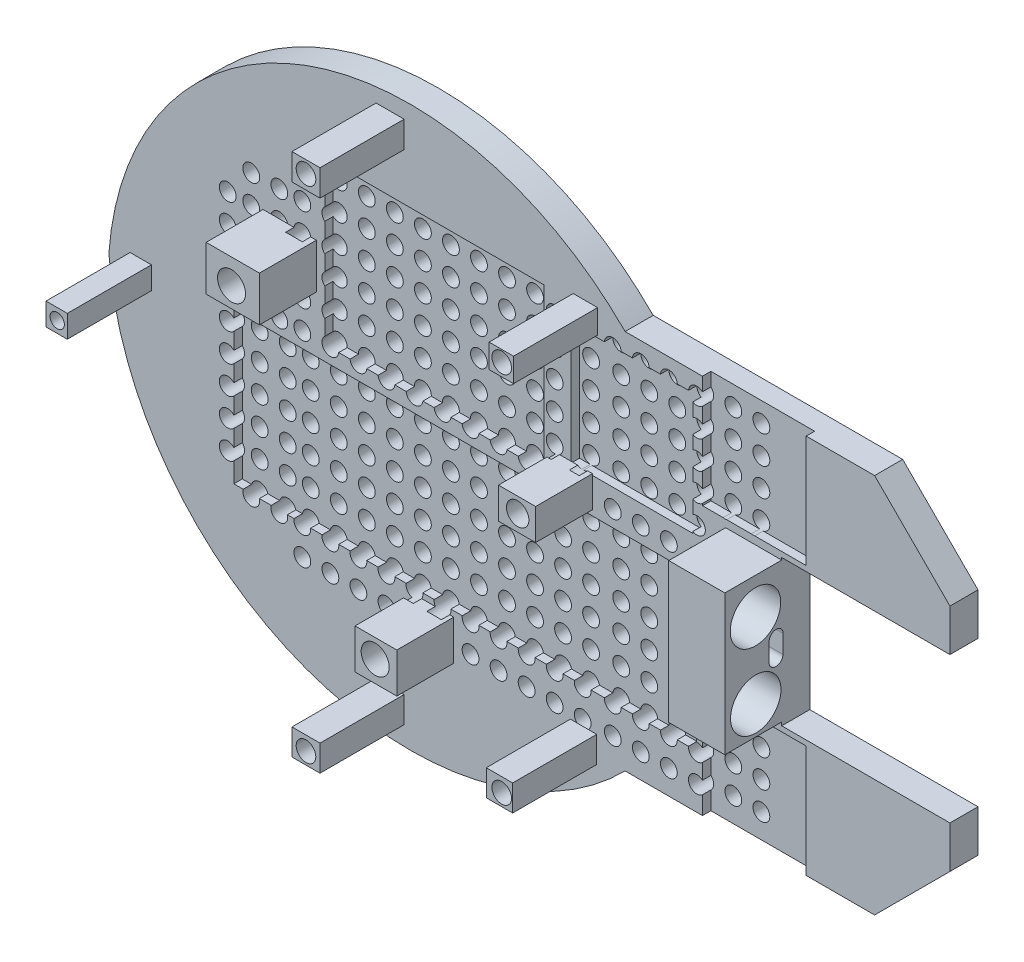
from build123d import *

# Parameters (mm, degrees)
BOSS_EXTRUDE1_DEPTH      = 10
BOSS_EXTRUDE1_DEPTH_BACK = 0.01
SKETCH3_W                = 37
SKETCH3_H                = 40
CUT_EXTRUDE1_DEPTH       = 3
SKETCH5_W                = 37
SKETCH5_H                = 40
CUT_EXTRUDE3_DEPTH       = 3
SKETCH7_W                = 165
SKETCH7_H                = 54
CUT_EXTRUDE4_DEPTH       = 3
SKETCH8_W                = 78.2
SKETCH8_H                = 57.5
CUT_EXTRUDE5_DEPTH       = 3
SKETCH9_W                = 19
SKETCH9_H                = 16
SKETCH9_W_2              = 13.23867097
SKETCH9_H_2              = 11.14338859
SKETCH9_W_3              = 14.8958404
SKETCH9_H_3              = 14.23867097
BOSS_EXTRUDE2_DEPTH      = 20.3
SKETCH11_R               = 3
CUT_EXTRUDE12_DEPTH      = 13
CUT_EXTRUDE13_REACH      = 263.683
SKETCH12_R               = 3
CUT_EXTRUDE14_REACH      = 263.683
SKETCH13_R               = 3
SKETCH14_R               = 3
CUT_EXTRUDE16_DEPTH      = 10.01
SKETCH15_W               = 20
SKETCH15_H               = 50
BOSS_EXTRUDE3_DEPTH      = 20.3
SKETCH16_W               = 7.597238681
SKETCH16_H               = 8
SKETCH16_W_2             = 10
SKETCH16_H_2             = 9.4
SKETCH16_W_3             = 8.7
SKETCH16_H_3             = 8.5
SKETCH16_W_4             = 9.4
SKETCH16_H_4             = 9.3
BOSS_EXTRUDE4_DEPTH      = 30
SKETCH17_R               = 2.55
SKETCH17_R_2             = 3.5
CUT_EXTRUDE17_DEPTH      = 263.98121496
SKETCH18_W               = 43.4
SKETCH18_H               = 43.4
CUT_EXTRUDE18_DEPTH      = 3
SKETCH20_R               = 5
SKETCH20_R_2             = 4
CUT_EXTRUDE20_DEPTH      = 263.98121496
CUT_EXTRUDE21_REACH      = 264.981
SKETCH21_R               = 9


with BuildPart() as part:
    # Sketch1 → Boss-Extrude1 (new, two sides: drawn at the far end of the back side and taken through both)
    with BuildSketch(Plane.XY.offset(-BOSS_EXTRUDE1_DEPTH_BACK)):
        with BuildLine():
            Line((0, 0), (0, -26))
            Line((0, -26), (60, -26))
            Line((60, -26), (60, -41))
            Line((60, -41), (33.129942315, -67.870057685))
            Line((33.129942315, -67.870057685), (-55.850057685, -67.870057685))
            ThreePointArc((-55.850057685, -67.870057685), (-169.745893523, -93.14097487), (-240, 0))
            ThreePointArc((-240, 0), (-169.745893523, 93.14097487), (-55.850057685, 67.870057685))
            Line((-55.850057685, 67.870057685), (33.129942315, 67.870057685))
            Line((33.129942315, 67.870057685), (60, 41))
            Line((60, 41), (60, 26))
            Line((60, 26), (0, 26))
            Line((0, 26), (0, 0))
        make_face()
    extrude(amount=BOSS_EXTRUDE1_DEPTH + BOSS_EXTRUDE1_DEPTH_BACK)

    # Sketch3 → Cut-Extrude1 (cut)
    with BuildSketch(Plane.XY.offset(10)):
        with Locations((-9.773002586, 47.870057685)):
            Rectangle(SKETCH3_W, SKETCH3_H)
    extrude(amount=-CUT_EXTRUDE1_DEPTH, mode=Mode.SUBTRACT)

    # Sketch5 → Cut-Extrude3 (cut)
    with BuildSketch(Plane.XY.offset(10)):
        with Locations((-9.773002586, -47.870057685)):
            Rectangle(SKETCH5_W, SKETCH5_H)
    extrude(amount=-CUT_EXTRUDE3_DEPTH, mode=Mode.SUBTRACT)

    # Sketch7 → Cut-Extrude4 (cut)
    with BuildSketch(Plane.XY.offset(10)):
        with Locations((-112.913094129, -21.943838981)):
            Rectangle(SKETCH7_W, SKETCH7_H)
    extrude(amount=-CUT_EXTRUDE4_DEPTH, mode=Mode.SUBTRACT)

    # Sketch8 → Cut-Extrude5 (cut)
    with BuildSketch(Plane.XY.offset(10)):
        with Locations((-123.892735612, 39.063262975)):
            Rectangle(SKETCH8_W, SKETCH8_H)
    extrude(amount=-CUT_EXTRUDE5_DEPTH, mode=Mode.SUBTRACT)

    # Sketch9 → Boss-Extrude2 (add)
    with BuildSketch(Plane.XY.offset(10)):
        with Locations((-175.5, 33)):
            Rectangle(SKETCH9_W, SKETCH9_H)
        with Locations((-74.112324575, 12.582539195)):
            Rectangle(SKETCH9_W_2, SKETCH9_H_2)
        with Locations((-124.438795754, -58.044490005)):
            Rectangle(SKETCH9_W_3, SKETCH9_H_3)
    extrude(amount=BOSS_EXTRUDE2_DEPTH)

    # Sketch11 → Cut-Extrude12 (cut)
    with BuildSketch(Plane(origin=(0, 0, -0.01), x_dir=(-1, 0, 0), z_dir=(0, 0, -1))):
        with Locations((70.989015497, 60.584399251)):
            Circle(SKETCH11_R)
        with Locations((80.989015497, 60.584399251)):
            Circle(SKETCH11_R)
        with Locations((90.989015497, 60.584399251)):
            Circle(SKETCH11_R)
        with Locations((100.989015497, 60.584399251)):
            Circle(SKETCH11_R)
        with Locations((110.989015497, 60.584399251)):
            Circle(SKETCH11_R)
        with Locations((120.989015497, 60.584399251)):
            Circle(SKETCH11_R)
        with Locations((130.989015497, 60.584399251)):
            Circle(SKETCH11_R)
        with Locations((140.989015497, 60.584399251)):
            Circle(SKETCH11_R)
        with Locations((150.989015497, 60.584399251)):
            Circle(SKETCH11_R)
        with Locations((160.989015497, 60.584399251)):
            Circle(SKETCH11_R)
        with Locations((170.989015497, 60.584399251)):
            Circle(SKETCH11_R)
        with Locations((80.989015497, 50.584399251)):
            Circle(SKETCH11_R)
        with Locations((90.989015497, 50.584399251)):
            Circle(SKETCH11_R)
        with Locations((100.989015497, 50.584399251)):
            Circle(SKETCH11_R)
        with Locations((110.989015497, 50.584399251)):
            Circle(SKETCH11_R)
        with Locations((120.989015497, 50.584399251)):
            Circle(SKETCH11_R)
        with Locations((130.989015497, 50.584399251)):
            Circle(SKETCH11_R)
        with Locations((140.989015497, 50.584399251)):
            Circle(SKETCH11_R)
        with Locations((150.989015497, 50.584399251)):
            Circle(SKETCH11_R)
        with Locations((160.989015497, 50.584399251)):
            Circle(SKETCH11_R)
        with Locations((170.989015497, 50.584399251)):
            Circle(SKETCH11_R)
        with Locations((80.989015497, 40.584399251)):
            Circle(SKETCH11_R)
        with Locations((90.989015497, 40.584399251)):
            Circle(SKETCH11_R)
        with Locations((100.989015497, 40.584399251)):
            Circle(SKETCH11_R)
        with Locations((110.989015497, 40.584399251)):
            Circle(SKETCH11_R)
        with Locations((120.989015497, 40.584399251)):
            Circle(SKETCH11_R)
        with Locations((130.989015497, 40.584399251)):
            Circle(SKETCH11_R)
        with Locations((140.989015497, 40.584399251)):
            Circle(SKETCH11_R)
        with Locations((150.989015497, 40.584399251)):
            Circle(SKETCH11_R)
        with Locations((160.989015497, 40.584399251)):
            Circle(SKETCH11_R)
        with Locations((170.989015497, 40.584399251)):
            Circle(SKETCH11_R)
        with Locations((80.989015497, 30.584399251)):
            Circle(SKETCH11_R)
        with Locations((90.989015497, 30.584399251)):
            Circle(SKETCH11_R)
        with Locations((100.989015497, 30.584399251)):
            Circle(SKETCH11_R)
        with Locations((110.989015497, 30.584399251)):
            Circle(SKETCH11_R)
        with Locations((120.989015497, 30.584399251)):
            Circle(SKETCH11_R)
        with Locations((130.989015497, 30.584399251)):
            Circle(SKETCH11_R)
        with Locations((140.989015497, 30.584399251)):
            Circle(SKETCH11_R)
        with Locations((150.989015497, 30.584399251)):
            Circle(SKETCH11_R)
        with Locations((160.989015497, 30.584399251)):
            Circle(SKETCH11_R)
        with Locations((170.989015497, 30.584399251)):
            Circle(SKETCH11_R)
        with Locations((80.989015497, 20.584399251)):
            Circle(SKETCH11_R)
        with Locations((90.989015497, 20.584399251)):
            Circle(SKETCH11_R)
        with Locations((100.989015497, 20.584399251)):
            Circle(SKETCH11_R)
        with Locations((110.989015497, 20.584399251)):
            Circle(SKETCH11_R)
        with Locations((120.989015497, 20.584399251)):
            Circle(SKETCH11_R)
        with Locations((130.989015497, 20.584399251)):
            Circle(SKETCH11_R)
        with Locations((140.989015497, 20.584399251)):
            Circle(SKETCH11_R)
        with Locations((150.989015497, 20.584399251)):
            Circle(SKETCH11_R)
        with Locations((160.989015497, 20.584399251)):
            Circle(SKETCH11_R)
        with Locations((170.989015497, 20.584399251)):
            Circle(SKETCH11_R)
        with Locations((80.989015497, 10.584399251)):
            Circle(SKETCH11_R)
        with Locations((90.989015497, 10.584399251)):
            Circle(SKETCH11_R)
        with Locations((100.989015497, 10.584399251)):
            Circle(SKETCH11_R)
        with Locations((110.989015497, 10.584399251)):
            Circle(SKETCH11_R)
        with Locations((120.989015497, 10.584399251)):
            Circle(SKETCH11_R)
        with Locations((130.989015497, 10.584399251)):
            Circle(SKETCH11_R)
        with Locations((140.989015497, 10.584399251)):
            Circle(SKETCH11_R)
        with Locations((150.989015497, 10.584399251)):
            Circle(SKETCH11_R)
        with Locations((160.989015497, 10.584399251)):
            Circle(SKETCH11_R)
        with Locations((170.989015497, 10.584399251)):
            Circle(SKETCH11_R)
        with Locations((80.989015497, 0.584399251)):
            Circle(SKETCH11_R)
        with Locations((90.989015497, 0.584399251)):
            Circle(SKETCH11_R)
        with Locations((100.989015497, 0.584399251)):
            Circle(SKETCH11_R)
        with Locations((110.989015497, 0.584399251)):
            Circle(SKETCH11_R)
        with Locations((120.989015497, 0.584399251)):
            Circle(SKETCH11_R)
        with Locations((130.989015497, 0.584399251)):
            Circle(SKETCH11_R)
        with Locations((140.989015497, 0.584399251)):
            Circle(SKETCH11_R)
        with Locations((150.989015497, 0.584399251)):
            Circle(SKETCH11_R)
        with Locations((160.989015497, 0.584399251)):
            Circle(SKETCH11_R)
        with Locations((170.989015497, 0.584399251)):
            Circle(SKETCH11_R)
        with Locations((80.989015497, -9.415600749)):
            Circle(SKETCH11_R)
        with Locations((90.989015497, -9.415600749)):
            Circle(SKETCH11_R)
        with Locations((100.989015497, -9.415600749)):
            Circle(SKETCH11_R)
        with Locations((110.989015497, -9.415600749)):
            Circle(SKETCH11_R)
        with Locations((120.989015497, -9.415600749)):
            Circle(SKETCH11_R)
        with Locations((130.989015497, -9.415600749)):
            Circle(SKETCH11_R)
        with Locations((140.989015497, -9.415600749)):
            Circle(SKETCH11_R)
        with Locations((150.989015497, -9.415600749)):
            Circle(SKETCH11_R)
        with Locations((160.989015497, -9.415600749)):
            Circle(SKETCH11_R)
        with Locations((170.989015497, -9.415600749)):
            Circle(SKETCH11_R)
        with Locations((80.989015497, -19.415600749)):
            Circle(SKETCH11_R)
        with Locations((90.989015497, -19.415600749)):
            Circle(SKETCH11_R)
        with Locations((100.989015497, -19.415600749)):
            Circle(SKETCH11_R)
        with Locations((110.989015497, -19.415600749)):
            Circle(SKETCH11_R)
        with Locations((120.989015497, -19.415600749)):
            Circle(SKETCH11_R)
        with Locations((130.989015497, -19.415600749)):
            Circle(SKETCH11_R)
        with Locations((140.989015497, -19.415600749)):
            Circle(SKETCH11_R)
        with Locations((150.989015497, -19.415600749)):
            Circle(SKETCH11_R)
        with Locations((160.989015497, -19.415600749)):
            Circle(SKETCH11_R)
        with Locations((170.989015497, -19.415600749)):
            Circle(SKETCH11_R)
        with Locations((80.989015497, -29.415600749)):
            Circle(SKETCH11_R)
        with Locations((90.989015497, -29.415600749)):
            Circle(SKETCH11_R)
        with Locations((100.989015497, -29.415600749)):
            Circle(SKETCH11_R)
        with Locations((110.989015497, -29.415600749)):
            Circle(SKETCH11_R)
        with Locations((120.989015497, -29.415600749)):
            Circle(SKETCH11_R)
        with Locations((130.989015497, -29.415600749)):
            Circle(SKETCH11_R)
        with Locations((140.989015497, -29.415600749)):
            Circle(SKETCH11_R)
        with Locations((150.989015497, -29.415600749)):
            Circle(SKETCH11_R)
        with Locations((160.989015497, -29.415600749)):
            Circle(SKETCH11_R)
        with Locations((170.989015497, -29.415600749)):
            Circle(SKETCH11_R)
        with Locations((80.989015497, -39.415600749)):
            Circle(SKETCH11_R)
        with Locations((90.989015497, -39.415600749)):
            Circle(SKETCH11_R)
        with Locations((100.989015497, -39.415600749)):
            Circle(SKETCH11_R)
        with Locations((110.989015497, -39.415600749)):
            Circle(SKETCH11_R)
        with Locations((120.989015497, -39.415600749)):
            Circle(SKETCH11_R)
        with Locations((130.989015497, -39.415600749)):
            Circle(SKETCH11_R)
        with Locations((140.989015497, -39.415600749)):
            Circle(SKETCH11_R)
        with Locations((150.989015497, -39.415600749)):
            Circle(SKETCH11_R)
        with Locations((160.989015497, -39.415600749)):
            Circle(SKETCH11_R)
        with Locations((170.989015497, -39.415600749)):
            Circle(SKETCH11_R)
        with Locations((80.989015497, -49.415600749)):
            Circle(SKETCH11_R)
        with Locations((90.989015497, -49.415600749)):
            Circle(SKETCH11_R)
        with Locations((100.989015497, -49.415600749)):
            Circle(SKETCH11_R)
        with Locations((110.989015497, -49.415600749)):
            Circle(SKETCH11_R)
        with Locations((120.989015497, -49.415600749)):
            Circle(SKETCH11_R)
        with Locations((130.989015497, -49.415600749)):
            Circle(SKETCH11_R)
        with Locations((140.989015497, -49.415600749)):
            Circle(SKETCH11_R)
        with Locations((150.989015497, -49.415600749)):
            Circle(SKETCH11_R)
        with Locations((160.989015497, -49.415600749)):
            Circle(SKETCH11_R)
        with Locations((170.989015497, -49.415600749)):
            Circle(SKETCH11_R)
        with Locations((80.989015497, -59.415600749)):
            Circle(SKETCH11_R)
        with Locations((90.989015497, -59.415600749)):
            Circle(SKETCH11_R)
        with Locations((100.989015497, -59.415600749)):
            Circle(SKETCH11_R)
        with Locations((110.989015497, -59.415600749)):
            Circle(SKETCH11_R)
        with Locations((120.989015497, -59.415600749)):
            Circle(SKETCH11_R)
        with Locations((130.989015497, -59.415600749)):
            Circle(SKETCH11_R)
        with Locations((140.989015497, -59.415600749)):
            Circle(SKETCH11_R)
        with Locations((150.989015497, -59.415600749)):
            Circle(SKETCH11_R)
        with Locations((160.989015497, -59.415600749)):
            Circle(SKETCH11_R)
        with Locations((170.989015497, -59.415600749)):
            Circle(SKETCH11_R)
        with Locations((70.989015497, 50.584399251)):
            Circle(SKETCH11_R)
        with Locations((70.989015497, 40.584399251)):
            Circle(SKETCH11_R)
        with Locations((70.989015497, 30.584399251)):
            Circle(SKETCH11_R)
        with Locations((70.989015497, 20.584399251)):
            Circle(SKETCH11_R)
        with Locations((70.989015497, 10.584399251)):
            Circle(SKETCH11_R)
        with Locations((70.989015497, 0.584399251)):
            Circle(SKETCH11_R)
        with Locations((70.989015497, -9.415600749)):
            Circle(SKETCH11_R)
        with Locations((70.989015497, -19.415600749)):
            Circle(SKETCH11_R)
        with Locations((70.989015497, -29.415600749)):
            Circle(SKETCH11_R)
        with Locations((70.989015497, -39.415600749)):
            Circle(SKETCH11_R)
        with Locations((70.989015497, -49.415600749)):
            Circle(SKETCH11_R)
        with Locations((70.989015497, -59.415600749)):
            Circle(SKETCH11_R)
    extrude(amount=-CUT_EXTRUDE12_DEPTH, mode=Mode.SUBTRACT)

    # Cut-Extrude13: up to this face of the body (flat: up to its plane)
    cut_extrude13_end = Plane(part.part.faces().sort_by_distance((56.396717085, 33.5, 10))[0])
    # Sketch12 → Cut-Extrude13 (cut, up to the picked face)
    with BuildSketch(Plane(origin=(0, 0, -0.01), x_dir=(-1, 0, 0), z_dir=(0, 0, -1)), mode=Mode.PRIVATE) as cut_extrude13_sk1:
        with Locations((179.20291487, 50.26025315)):
            Circle(SKETCH12_R)
    cut_extrude13_tool1 = split(extrude(cut_extrude13_sk1.sketch, amount=-CUT_EXTRUDE13_REACH, mode=Mode.PRIVATE), bisect_by=cut_extrude13_end, keep=Keep.BOTH, mode=Mode.PRIVATE)
    # Sketch12 → Cut-Extrude13 (cut, up to the picked face)
    with BuildSketch(Plane(origin=(0, 0, -0.01), x_dir=(-1, 0, 0), z_dir=(0, 0, -1)), mode=Mode.PRIVATE) as cut_extrude13_sk2:
        with Locations((189.20291487, 50.26025315)):
            Circle(SKETCH12_R)
    cut_extrude13_tool2 = split(extrude(cut_extrude13_sk2.sketch, amount=-CUT_EXTRUDE13_REACH, mode=Mode.PRIVATE), bisect_by=cut_extrude13_end, keep=Keep.BOTH, mode=Mode.PRIVATE)
    # Sketch12 → Cut-Extrude13 (cut, up to the picked face)
    with BuildSketch(Plane(origin=(0, 0, -0.01), x_dir=(-1, 0, 0), z_dir=(0, 0, -1)), mode=Mode.PRIVATE) as cut_extrude13_sk3:
        with Locations((189.20291487, 40.26025315)):
            Circle(SKETCH12_R)
    cut_extrude13_tool3 = split(extrude(cut_extrude13_sk3.sketch, amount=-CUT_EXTRUDE13_REACH, mode=Mode.PRIVATE), bisect_by=cut_extrude13_end, keep=Keep.BOTH, mode=Mode.PRIVATE)
    # Sketch12 → Cut-Extrude13 (cut, up to the picked face)
    with BuildSketch(Plane(origin=(0, 0, -0.01), x_dir=(-1, 0, 0), z_dir=(0, 0, -1)), mode=Mode.PRIVATE) as cut_extrude13_sk4:
        with Locations((189.20291487, 30.26025315)):
            Circle(SKETCH12_R)
    cut_extrude13_tool4 = split(extrude(cut_extrude13_sk4.sketch, amount=-CUT_EXTRUDE13_REACH, mode=Mode.PRIVATE), bisect_by=cut_extrude13_end, keep=Keep.BOTH, mode=Mode.PRIVATE)
    # Sketch12 → Cut-Extrude13 (cut, up to the picked face)
    with BuildSketch(Plane(origin=(0, 0, -0.01), x_dir=(-1, 0, 0), z_dir=(0, 0, -1)), mode=Mode.PRIVATE) as cut_extrude13_sk5:
        with Locations((189.20291487, 20.26025315)):
            Circle(SKETCH12_R)
    cut_extrude13_tool5 = split(extrude(cut_extrude13_sk5.sketch, amount=-CUT_EXTRUDE13_REACH, mode=Mode.PRIVATE), bisect_by=cut_extrude13_end, keep=Keep.BOTH, mode=Mode.PRIVATE)
    # Sketch12 → Cut-Extrude13 (cut, up to the picked face)
    with BuildSketch(Plane(origin=(0, 0, -0.01), x_dir=(-1, 0, 0), z_dir=(0, 0, -1)), mode=Mode.PRIVATE) as cut_extrude13_sk6:
        with Locations((189.20291487, 10.26025315)):
            Circle(SKETCH12_R)
    cut_extrude13_tool6 = split(extrude(cut_extrude13_sk6.sketch, amount=-CUT_EXTRUDE13_REACH, mode=Mode.PRIVATE), bisect_by=cut_extrude13_end, keep=Keep.BOTH, mode=Mode.PRIVATE)
    # Sketch12 → Cut-Extrude13 (cut, up to the picked face)
    with BuildSketch(Plane(origin=(0, 0, -0.01), x_dir=(-1, 0, 0), z_dir=(0, 0, -1)), mode=Mode.PRIVATE) as cut_extrude13_sk7:
        with Locations((189.20291487, 0.26025315)):
            Circle(SKETCH12_R)
    cut_extrude13_tool7 = split(extrude(cut_extrude13_sk7.sketch, amount=-CUT_EXTRUDE13_REACH, mode=Mode.PRIVATE), bisect_by=cut_extrude13_end, keep=Keep.BOTH, mode=Mode.PRIVATE)
    # Sketch12 → Cut-Extrude13 (cut, up to the picked face)
    with BuildSketch(Plane(origin=(0, 0, -0.01), x_dir=(-1, 0, 0), z_dir=(0, 0, -1)), mode=Mode.PRIVATE) as cut_extrude13_sk8:
        with Locations((189.20291487, -9.73974685)):
            Circle(SKETCH12_R)
    cut_extrude13_tool8 = split(extrude(cut_extrude13_sk8.sketch, amount=-CUT_EXTRUDE13_REACH, mode=Mode.PRIVATE), bisect_by=cut_extrude13_end, keep=Keep.BOTH, mode=Mode.PRIVATE)
    # Sketch12 → Cut-Extrude13 (cut, up to the picked face)
    with BuildSketch(Plane(origin=(0, 0, -0.01), x_dir=(-1, 0, 0), z_dir=(0, 0, -1)), mode=Mode.PRIVATE) as cut_extrude13_sk9:
        with Locations((189.20291487, -19.73974685)):
            Circle(SKETCH12_R)
    cut_extrude13_tool9 = split(extrude(cut_extrude13_sk9.sketch, amount=-CUT_EXTRUDE13_REACH, mode=Mode.PRIVATE), bisect_by=cut_extrude13_end, keep=Keep.BOTH, mode=Mode.PRIVATE)
    # Sketch12 → Cut-Extrude13 (cut, up to the picked face)
    with BuildSketch(Plane(origin=(0, 0, -0.01), x_dir=(-1, 0, 0), z_dir=(0, 0, -1)), mode=Mode.PRIVATE) as cut_extrude13_sk10:
        with Locations((189.20291487, -29.73974685)):
            Circle(SKETCH12_R)
    cut_extrude13_tool10 = split(extrude(cut_extrude13_sk10.sketch, amount=-CUT_EXTRUDE13_REACH, mode=Mode.PRIVATE), bisect_by=cut_extrude13_end, keep=Keep.BOTH, mode=Mode.PRIVATE)
    # Sketch12 → Cut-Extrude13 (cut, up to the picked face)
    with BuildSketch(Plane(origin=(0, 0, -0.01), x_dir=(-1, 0, 0), z_dir=(0, 0, -1)), mode=Mode.PRIVATE) as cut_extrude13_sk11:
        with Locations((189.20291487, -39.73974685)):
            Circle(SKETCH12_R)
    cut_extrude13_tool11 = split(extrude(cut_extrude13_sk11.sketch, amount=-CUT_EXTRUDE13_REACH, mode=Mode.PRIVATE), bisect_by=cut_extrude13_end, keep=Keep.BOTH, mode=Mode.PRIVATE)
    # Sketch12 → Cut-Extrude13 (cut, up to the picked face)
    with BuildSketch(Plane(origin=(0, 0, -0.01), x_dir=(-1, 0, 0), z_dir=(0, 0, -1)), mode=Mode.PRIVATE) as cut_extrude13_sk12:
        with Locations((189.20291487, -49.73974685)):
            Circle(SKETCH12_R)
    cut_extrude13_tool12 = split(extrude(cut_extrude13_sk12.sketch, amount=-CUT_EXTRUDE13_REACH, mode=Mode.PRIVATE), bisect_by=cut_extrude13_end, keep=Keep.BOTH, mode=Mode.PRIVATE)
    # Sketch12 → Cut-Extrude13 (cut, up to the picked face)
    with BuildSketch(Plane(origin=(0, 0, -0.01), x_dir=(-1, 0, 0), z_dir=(0, 0, -1)), mode=Mode.PRIVATE) as cut_extrude13_sk13:
        with Locations((179.20291487, 40.26025315)):
            Circle(SKETCH12_R)
    cut_extrude13_tool13 = split(extrude(cut_extrude13_sk13.sketch, amount=-CUT_EXTRUDE13_REACH, mode=Mode.PRIVATE), bisect_by=cut_extrude13_end, keep=Keep.BOTH, mode=Mode.PRIVATE)
    # Sketch12 → Cut-Extrude13 (cut, up to the picked face)
    with BuildSketch(Plane(origin=(0, 0, -0.01), x_dir=(-1, 0, 0), z_dir=(0, 0, -1)), mode=Mode.PRIVATE) as cut_extrude13_sk14:
        with Locations((179.20291487, 30.26025315)):
            Circle(SKETCH12_R)
    cut_extrude13_tool14 = split(extrude(cut_extrude13_sk14.sketch, amount=-CUT_EXTRUDE13_REACH, mode=Mode.PRIVATE), bisect_by=cut_extrude13_end, keep=Keep.BOTH, mode=Mode.PRIVATE)
    # Sketch12 → Cut-Extrude13 (cut, up to the picked face)
    with BuildSketch(Plane(origin=(0, 0, -0.01), x_dir=(-1, 0, 0), z_dir=(0, 0, -1)), mode=Mode.PRIVATE) as cut_extrude13_sk15:
        with Locations((179.20291487, 20.26025315)):
            Circle(SKETCH12_R)
    cut_extrude13_tool15 = split(extrude(cut_extrude13_sk15.sketch, amount=-CUT_EXTRUDE13_REACH, mode=Mode.PRIVATE), bisect_by=cut_extrude13_end, keep=Keep.BOTH, mode=Mode.PRIVATE)
    # Sketch12 → Cut-Extrude13 (cut, up to the picked face)
    with BuildSketch(Plane(origin=(0, 0, -0.01), x_dir=(-1, 0, 0), z_dir=(0, 0, -1)), mode=Mode.PRIVATE) as cut_extrude13_sk16:
        with Locations((179.20291487, 10.26025315)):
            Circle(SKETCH12_R)
    cut_extrude13_tool16 = split(extrude(cut_extrude13_sk16.sketch, amount=-CUT_EXTRUDE13_REACH, mode=Mode.PRIVATE), bisect_by=cut_extrude13_end, keep=Keep.BOTH, mode=Mode.PRIVATE)
    # Sketch12 → Cut-Extrude13 (cut, up to the picked face)
    with BuildSketch(Plane(origin=(0, 0, -0.01), x_dir=(-1, 0, 0), z_dir=(0, 0, -1)), mode=Mode.PRIVATE) as cut_extrude13_sk17:
        with Locations((179.20291487, 0.26025315)):
            Circle(SKETCH12_R)
    cut_extrude13_tool17 = split(extrude(cut_extrude13_sk17.sketch, amount=-CUT_EXTRUDE13_REACH, mode=Mode.PRIVATE), bisect_by=cut_extrude13_end, keep=Keep.BOTH, mode=Mode.PRIVATE)
    # Sketch12 → Cut-Extrude13 (cut, up to the picked face)
    with BuildSketch(Plane(origin=(0, 0, -0.01), x_dir=(-1, 0, 0), z_dir=(0, 0, -1)), mode=Mode.PRIVATE) as cut_extrude13_sk18:
        with Locations((179.20291487, -9.73974685)):
            Circle(SKETCH12_R)
    cut_extrude13_tool18 = split(extrude(cut_extrude13_sk18.sketch, amount=-CUT_EXTRUDE13_REACH, mode=Mode.PRIVATE), bisect_by=cut_extrude13_end, keep=Keep.BOTH, mode=Mode.PRIVATE)
    # Sketch12 → Cut-Extrude13 (cut, up to the picked face)
    with BuildSketch(Plane(origin=(0, 0, -0.01), x_dir=(-1, 0, 0), z_dir=(0, 0, -1)), mode=Mode.PRIVATE) as cut_extrude13_sk19:
        with Locations((179.20291487, -19.73974685)):
            Circle(SKETCH12_R)
    cut_extrude13_tool19 = split(extrude(cut_extrude13_sk19.sketch, amount=-CUT_EXTRUDE13_REACH, mode=Mode.PRIVATE), bisect_by=cut_extrude13_end, keep=Keep.BOTH, mode=Mode.PRIVATE)
    # Sketch12 → Cut-Extrude13 (cut, up to the picked face)
    with BuildSketch(Plane(origin=(0, 0, -0.01), x_dir=(-1, 0, 0), z_dir=(0, 0, -1)), mode=Mode.PRIVATE) as cut_extrude13_sk20:
        with Locations((179.20291487, -29.73974685)):
            Circle(SKETCH12_R)
    cut_extrude13_tool20 = split(extrude(cut_extrude13_sk20.sketch, amount=-CUT_EXTRUDE13_REACH, mode=Mode.PRIVATE), bisect_by=cut_extrude13_end, keep=Keep.BOTH, mode=Mode.PRIVATE)
    # Sketch12 → Cut-Extrude13 (cut, up to the picked face)
    with BuildSketch(Plane(origin=(0, 0, -0.01), x_dir=(-1, 0, 0), z_dir=(0, 0, -1)), mode=Mode.PRIVATE) as cut_extrude13_sk21:
        with Locations((179.20291487, -39.73974685)):
            Circle(SKETCH12_R)
    cut_extrude13_tool21 = split(extrude(cut_extrude13_sk21.sketch, amount=-CUT_EXTRUDE13_REACH, mode=Mode.PRIVATE), bisect_by=cut_extrude13_end, keep=Keep.BOTH, mode=Mode.PRIVATE)
    # Sketch12 → Cut-Extrude13 (cut, up to the picked face)
    with BuildSketch(Plane(origin=(0, 0, -0.01), x_dir=(-1, 0, 0), z_dir=(0, 0, -1)), mode=Mode.PRIVATE) as cut_extrude13_sk22:
        with Locations((179.20291487, -49.73974685)):
            Circle(SKETCH12_R)
    cut_extrude13_tool22 = split(extrude(cut_extrude13_sk22.sketch, amount=-CUT_EXTRUDE13_REACH, mode=Mode.PRIVATE), bisect_by=cut_extrude13_end, keep=Keep.BOTH, mode=Mode.PRIVATE)
    add(cut_extrude13_tool1.solids().sort_by(Axis((-179.202915, 50.260253, -0.01), (0, 0, 1)))[0], mode=Mode.SUBTRACT)
    add(cut_extrude13_tool2.solids().sort_by(Axis((-189.202915, 50.260253, -0.01), (0, 0, 1)))[0], mode=Mode.SUBTRACT)
    add(cut_extrude13_tool3.solids().sort_by(Axis((-189.202915, 40.260253, -0.01), (0, 0, 1)))[0], mode=Mode.SUBTRACT)
    add(cut_extrude13_tool4.solids().sort_by(Axis((-189.202915, 30.260253, -0.01), (0, 0, 1)))[0], mode=Mode.SUBTRACT)
    add(cut_extrude13_tool5.solids().sort_by(Axis((-189.202915, 20.260253, -0.01), (0, 0, 1)))[0], mode=Mode.SUBTRACT)
    add(cut_extrude13_tool6.solids().sort_by(Axis((-189.202915, 10.260253, -0.01), (0, 0, 1)))[0], mode=Mode.SUBTRACT)
    add(cut_extrude13_tool7.solids().sort_by(Axis((-189.202915, 0.260253, -0.01), (0, 0, 1)))[0], mode=Mode.SUBTRACT)
    add(cut_extrude13_tool8.solids().sort_by(Axis((-189.202915, -9.739747, -0.01), (0, 0, 1)))[0], mode=Mode.SUBTRACT)
    add(cut_extrude13_tool9.solids().sort_by(Axis((-189.202915, -19.739747, -0.01), (0, 0, 1)))[0], mode=Mode.SUBTRACT)
    add(cut_extrude13_tool10.solids().sort_by(Axis((-189.202915, -29.739747, -0.01), (0, 0, 1)))[0], mode=Mode.SUBTRACT)
    add(cut_extrude13_tool11.solids().sort_by(Axis((-189.202915, -39.739747, -0.01), (0, 0, 1)))[0], mode=Mode.SUBTRACT)
    add(cut_extrude13_tool12.solids().sort_by(Axis((-189.202915, -49.739747, -0.01), (0, 0, 1)))[0], mode=Mode.SUBTRACT)
    add(cut_extrude13_tool13.solids().sort_by(Axis((-179.202915, 40.260253, -0.01), (0, 0, 1)))[0], mode=Mode.SUBTRACT)
    add(cut_extrude13_tool14.solids().sort_by(Axis((-179.202915, 30.260253, -0.01), (0, 0, 1)))[0], mode=Mode.SUBTRACT)
    add(cut_extrude13_tool15.solids().sort_by(Axis((-179.202915, 20.260253, -0.01), (0, 0, 1)))[0], mode=Mode.SUBTRACT)
    add(cut_extrude13_tool16.solids().sort_by(Axis((-179.202915, 10.260253, -0.01), (0, 0, 1)))[0], mode=Mode.SUBTRACT)
    add(cut_extrude13_tool17.solids().sort_by(Axis((-179.202915, 0.260253, -0.01), (0, 0, 1)))[0], mode=Mode.SUBTRACT)
    add(cut_extrude13_tool18.solids().sort_by(Axis((-179.202915, -9.739747, -0.01), (0, 0, 1)))[0], mode=Mode.SUBTRACT)
    add(cut_extrude13_tool19.solids().sort_by(Axis((-179.202915, -19.739747, -0.01), (0, 0, 1)))[0], mode=Mode.SUBTRACT)
    add(cut_extrude13_tool20.solids().sort_by(Axis((-179.202915, -29.739747, -0.01), (0, 0, 1)))[0], mode=Mode.SUBTRACT)
    add(cut_extrude13_tool21.solids().sort_by(Axis((-179.202915, -39.739747, -0.01), (0, 0, 1)))[0], mode=Mode.SUBTRACT)
    add(cut_extrude13_tool22.solids().sort_by(Axis((-179.202915, -49.739747, -0.01), (0, 0, 1)))[0], mode=Mode.SUBTRACT)

    # Cut-Extrude14: up to this face of the body (flat: up to its plane)
    cut_extrude14_end = Plane(part.part.faces().sort_by_distance((56.396717085, 33.5, 10))[0])
    # Sketch13 → Cut-Extrude14 (cut, up to the picked face)
    with BuildSketch(Plane(origin=(0, 0, -0.01), x_dir=(-1, 0, 0), z_dir=(0, 0, -1)), mode=Mode.PRIVATE) as cut_extrude14_sk1:
        with Locations((197.603658893, 40.21214694)):
            Circle(SKETCH13_R)
    cut_extrude14_tool1 = split(extrude(cut_extrude14_sk1.sketch, amount=-CUT_EXTRUDE14_REACH, mode=Mode.PRIVATE), bisect_by=cut_extrude14_end, keep=Keep.BOTH, mode=Mode.PRIVATE)
    # Sketch13 → Cut-Extrude14 (cut, up to the picked face)
    with BuildSketch(Plane(origin=(0, 0, -0.01), x_dir=(-1, 0, 0), z_dir=(0, 0, -1)), mode=Mode.PRIVATE) as cut_extrude14_sk2:
        with Locations((197.603658893, 30.21214694)):
            Circle(SKETCH13_R)
    cut_extrude14_tool2 = split(extrude(cut_extrude14_sk2.sketch, amount=-CUT_EXTRUDE14_REACH, mode=Mode.PRIVATE), bisect_by=cut_extrude14_end, keep=Keep.BOTH, mode=Mode.PRIVATE)
    # Sketch13 → Cut-Extrude14 (cut, up to the picked face)
    with BuildSketch(Plane(origin=(0, 0, -0.01), x_dir=(-1, 0, 0), z_dir=(0, 0, -1)), mode=Mode.PRIVATE) as cut_extrude14_sk3:
        with Locations((197.603658893, 20.21214694)):
            Circle(SKETCH13_R)
    cut_extrude14_tool3 = split(extrude(cut_extrude14_sk3.sketch, amount=-CUT_EXTRUDE14_REACH, mode=Mode.PRIVATE), bisect_by=cut_extrude14_end, keep=Keep.BOTH, mode=Mode.PRIVATE)
    # Sketch13 → Cut-Extrude14 (cut, up to the picked face)
    with BuildSketch(Plane(origin=(0, 0, -0.01), x_dir=(-1, 0, 0), z_dir=(0, 0, -1)), mode=Mode.PRIVATE) as cut_extrude14_sk4:
        with Locations((197.603658893, 10.21214694)):
            Circle(SKETCH13_R)
    cut_extrude14_tool4 = split(extrude(cut_extrude14_sk4.sketch, amount=-CUT_EXTRUDE14_REACH, mode=Mode.PRIVATE), bisect_by=cut_extrude14_end, keep=Keep.BOTH, mode=Mode.PRIVATE)
    # Sketch13 → Cut-Extrude14 (cut, up to the picked face)
    with BuildSketch(Plane(origin=(0, 0, -0.01), x_dir=(-1, 0, 0), z_dir=(0, 0, -1)), mode=Mode.PRIVATE) as cut_extrude14_sk5:
        with Locations((197.603658893, 0.21214694)):
            Circle(SKETCH13_R)
    cut_extrude14_tool5 = split(extrude(cut_extrude14_sk5.sketch, amount=-CUT_EXTRUDE14_REACH, mode=Mode.PRIVATE), bisect_by=cut_extrude14_end, keep=Keep.BOTH, mode=Mode.PRIVATE)
    # Sketch13 → Cut-Extrude14 (cut, up to the picked face)
    with BuildSketch(Plane(origin=(0, 0, -0.01), x_dir=(-1, 0, 0), z_dir=(0, 0, -1)), mode=Mode.PRIVATE) as cut_extrude14_sk6:
        with Locations((197.603658893, -9.78785306)):
            Circle(SKETCH13_R)
    cut_extrude14_tool6 = split(extrude(cut_extrude14_sk6.sketch, amount=-CUT_EXTRUDE14_REACH, mode=Mode.PRIVATE), bisect_by=cut_extrude14_end, keep=Keep.BOTH, mode=Mode.PRIVATE)
    # Sketch13 → Cut-Extrude14 (cut, up to the picked face)
    with BuildSketch(Plane(origin=(0, 0, -0.01), x_dir=(-1, 0, 0), z_dir=(0, 0, -1)), mode=Mode.PRIVATE) as cut_extrude14_sk7:
        with Locations((197.603658893, -19.78785306)):
            Circle(SKETCH13_R)
    cut_extrude14_tool7 = split(extrude(cut_extrude14_sk7.sketch, amount=-CUT_EXTRUDE14_REACH, mode=Mode.PRIVATE), bisect_by=cut_extrude14_end, keep=Keep.BOTH, mode=Mode.PRIVATE)
    # Sketch13 → Cut-Extrude14 (cut, up to the picked face)
    with BuildSketch(Plane(origin=(0, 0, -0.01), x_dir=(-1, 0, 0), z_dir=(0, 0, -1)), mode=Mode.PRIVATE) as cut_extrude14_sk8:
        with Locations((197.603658893, -29.78785306)):
            Circle(SKETCH13_R)
    cut_extrude14_tool8 = split(extrude(cut_extrude14_sk8.sketch, amount=-CUT_EXTRUDE14_REACH, mode=Mode.PRIVATE), bisect_by=cut_extrude14_end, keep=Keep.BOTH, mode=Mode.PRIVATE)
    # Sketch13 → Cut-Extrude14 (cut, up to the picked face)
    with BuildSketch(Plane(origin=(0, 0, -0.01), x_dir=(-1, 0, 0), z_dir=(0, 0, -1)), mode=Mode.PRIVATE) as cut_extrude14_sk9:
        with Locations((197.603658893, -39.78785306)):
            Circle(SKETCH13_R)
    cut_extrude14_tool9 = split(extrude(cut_extrude14_sk9.sketch, amount=-CUT_EXTRUDE14_REACH, mode=Mode.PRIVATE), bisect_by=cut_extrude14_end, keep=Keep.BOTH, mode=Mode.PRIVATE)
    add(cut_extrude14_tool1.solids().sort_by(Axis((-197.603659, 40.212147, -0.01), (0, 0, 1)))[0], mode=Mode.SUBTRACT)
    add(cut_extrude14_tool2.solids().sort_by(Axis((-197.603659, 30.212147, -0.01), (0, 0, 1)))[0], mode=Mode.SUBTRACT)
    add(cut_extrude14_tool3.solids().sort_by(Axis((-197.603659, 20.212147, -0.01), (0, 0, 1)))[0], mode=Mode.SUBTRACT)
    add(cut_extrude14_tool4.solids().sort_by(Axis((-197.603659, 10.212147, -0.01), (0, 0, 1)))[0], mode=Mode.SUBTRACT)
    add(cut_extrude14_tool5.solids().sort_by(Axis((-197.603659, 0.212147, -0.01), (0, 0, 1)))[0], mode=Mode.SUBTRACT)
    add(cut_extrude14_tool6.solids().sort_by(Axis((-197.603659, -9.787853, -0.01), (0, 0, 1)))[0], mode=Mode.SUBTRACT)
    add(cut_extrude14_tool7.solids().sort_by(Axis((-197.603659, -19.787853, -0.01), (0, 0, 1)))[0], mode=Mode.SUBTRACT)
    add(cut_extrude14_tool8.solids().sort_by(Axis((-197.603659, -29.787853, -0.01), (0, 0, 1)))[0], mode=Mode.SUBTRACT)
    add(cut_extrude14_tool9.solids().sort_by(Axis((-197.603659, -39.787853, -0.01), (0, 0, 1)))[0], mode=Mode.SUBTRACT)

    # Sketch14 → Cut-Extrude16 (cut)
    with BuildSketch(Plane(origin=(0, 0, -0.01), x_dir=(-1, 0, 0), z_dir=(0, 0, -1))):
        with Locations((60.25524815, 60.803455728)):
            Circle(SKETCH14_R)
        with Locations((50.25524815, 60.803455728)):
            Circle(SKETCH14_R)
        with Locations((40.25524815, 60.803455728)):
            Circle(SKETCH14_R)
        with Locations((30.25524815, 60.803455728)):
            Circle(SKETCH14_R)
        with Locations((20.25524815, 60.803455728)):
            Circle(SKETCH14_R)
        with Locations((10.25524815, 60.803455728)):
            Circle(SKETCH14_R)
        with Locations((50.25524815, 50.803455728)):
            Circle(SKETCH14_R)
        with Locations((40.25524815, 50.803455728)):
            Circle(SKETCH14_R)
        with Locations((30.25524815, 50.803455728)):
            Circle(SKETCH14_R)
        with Locations((20.25524815, 50.803455728)):
            Circle(SKETCH14_R)
        with Locations((10.25524815, 50.803455728)):
            Circle(SKETCH14_R)
        with Locations((50.25524815, 40.803455728)):
            Circle(SKETCH14_R)
        with Locations((40.25524815, 40.803455728)):
            Circle(SKETCH14_R)
        with Locations((30.25524815, 40.803455728)):
            Circle(SKETCH14_R)
        with Locations((20.25524815, 40.803455728)):
            Circle(SKETCH14_R)
        with Locations((10.25524815, 40.803455728)):
            Circle(SKETCH14_R)
        with Locations((50.25524815, 30.803455728)):
            Circle(SKETCH14_R)
        with Locations((40.25524815, 30.803455728)):
            Circle(SKETCH14_R)
        with Locations((30.25524815, 30.803455728)):
            Circle(SKETCH14_R)
        with Locations((20.25524815, 30.803455728)):
            Circle(SKETCH14_R)
        with Locations((10.25524815, 30.803455728)):
            Circle(SKETCH14_R)
        with Locations((50.25524815, 20.803455728)):
            Circle(SKETCH14_R)
        with Locations((40.25524815, 20.803455728)):
            Circle(SKETCH14_R)
        with Locations((30.25524815, 20.803455728)):
            Circle(SKETCH14_R)
        with Locations((20.25524815, 20.803455728)):
            Circle(SKETCH14_R)
        with Locations((10.25524815, 20.803455728)):
            Circle(SKETCH14_R)
        with Locations((50.25524815, 10.803455728)):
            Circle(SKETCH14_R)
        with Locations((40.25524815, 10.803455728)):
            Circle(SKETCH14_R)
        with Locations((30.25524815, 10.803455728)):
            Circle(SKETCH14_R)
        with Locations((20.25524815, 10.803455728)):
            Circle(SKETCH14_R)
        with Locations((10.25524815, 10.803455728)):
            Circle(SKETCH14_R)
        with Locations((50.25524815, 0.803455728)):
            Circle(SKETCH14_R)
        with Locations((40.25524815, 0.803455728)):
            Circle(SKETCH14_R)
        with Locations((30.25524815, 0.803455728)):
            Circle(SKETCH14_R)
        with Locations((20.25524815, 0.803455728)):
            Circle(SKETCH14_R)
        with Locations((10.25524815, 0.803455728)):
            Circle(SKETCH14_R)
        with Locations((50.25524815, -9.196544272)):
            Circle(SKETCH14_R)
        with Locations((40.25524815, -9.196544272)):
            Circle(SKETCH14_R)
        with Locations((30.25524815, -9.196544272)):
            Circle(SKETCH14_R)
        with Locations((20.25524815, -9.196544272)):
            Circle(SKETCH14_R)
        with Locations((10.25524815, -9.196544272)):
            Circle(SKETCH14_R)
        with Locations((50.25524815, -19.196544272)):
            Circle(SKETCH14_R)
        with Locations((40.25524815, -19.196544272)):
            Circle(SKETCH14_R)
        with Locations((30.25524815, -19.196544272)):
            Circle(SKETCH14_R)
        with Locations((20.25524815, -19.196544272)):
            Circle(SKETCH14_R)
        with Locations((10.25524815, -19.196544272)):
            Circle(SKETCH14_R)
        with Locations((50.25524815, -29.196544272)):
            Circle(SKETCH14_R)
        with Locations((40.25524815, -29.196544272)):
            Circle(SKETCH14_R)
        with Locations((30.25524815, -29.196544272)):
            Circle(SKETCH14_R)
        with Locations((20.25524815, -29.196544272)):
            Circle(SKETCH14_R)
        with Locations((10.25524815, -29.196544272)):
            Circle(SKETCH14_R)
        with Locations((50.25524815, -39.196544272)):
            Circle(SKETCH14_R)
        with Locations((40.25524815, -39.196544272)):
            Circle(SKETCH14_R)
        with Locations((30.25524815, -39.196544272)):
            Circle(SKETCH14_R)
        with Locations((20.25524815, -39.196544272)):
            Circle(SKETCH14_R)
        with Locations((10.25524815, -39.196544272)):
            Circle(SKETCH14_R)
        with Locations((50.25524815, -49.196544272)):
            Circle(SKETCH14_R)
        with Locations((40.25524815, -49.196544272)):
            Circle(SKETCH14_R)
        with Locations((30.25524815, -49.196544272)):
            Circle(SKETCH14_R)
        with Locations((20.25524815, -49.196544272)):
            Circle(SKETCH14_R)
        with Locations((10.25524815, -49.196544272)):
            Circle(SKETCH14_R)
        with Locations((50.25524815, -59.196544272)):
            Circle(SKETCH14_R)
        with Locations((40.25524815, -59.196544272)):
            Circle(SKETCH14_R)
        with Locations((30.25524815, -59.196544272)):
            Circle(SKETCH14_R)
        with Locations((20.25524815, -59.196544272)):
            Circle(SKETCH14_R)
        with Locations((10.25524815, -59.196544272)):
            Circle(SKETCH14_R)
        with Locations((60.25524815, 50.803455728)):
            Circle(SKETCH14_R)
        with Locations((60.25524815, 40.803455728)):
            Circle(SKETCH14_R)
        with Locations((60.25524815, 30.803455728)):
            Circle(SKETCH14_R)
        with Locations((60.25524815, 20.803455728)):
            Circle(SKETCH14_R)
        with Locations((60.25524815, 10.803455728)):
            Circle(SKETCH14_R)
        with Locations((60.25524815, 0.803455728)):
            Circle(SKETCH14_R)
        with Locations((60.25524815, -9.196544272)):
            Circle(SKETCH14_R)
        with Locations((60.25524815, -19.196544272)):
            Circle(SKETCH14_R)
        with Locations((60.25524815, -29.196544272)):
            Circle(SKETCH14_R)
        with Locations((60.25524815, -39.196544272)):
            Circle(SKETCH14_R)
        with Locations((60.25524815, -49.196544272)):
            Circle(SKETCH14_R)
        with Locations((60.25524815, -59.196544272)):
            Circle(SKETCH14_R)
    extrude(amount=-CUT_EXTRUDE16_DEPTH, mode=Mode.SUBTRACT)

    # Sketch15 → Boss-Extrude3 (add)
    with BuildSketch(Plane.XY.offset(10)):
        with Locations((-10, 0.20156489)):
            Rectangle(SKETCH15_W, SKETCH15_H)
    extrude(amount=BOSS_EXTRUDE3_DEPTH)

    # Sketch16 → Boss-Extrude4 (add)
    with BuildSketch(Plane.XY.offset(10)):
        with Locations((-228.62215183, 0)):
            Rectangle(SKETCH16_W, SKETCH16_H)
        with Locations((-139.68812176, 89.3492876)):
            Rectangle(SKETCH16_W_2, SKETCH16_H_2)
        with Locations((-70.02791219, 66.09880262)):
            Rectangle(SKETCH16_W_3, SKETCH16_H_3)
        with Locations((-70.67791219, -66.2732878)):
            Rectangle(SKETCH16_W_4, SKETCH16_H_4)
        with Locations((-139.68812176, -88.33151307)):
            Rectangle(SKETCH16_W_2, SKETCH16_H_4)
    extrude(amount=BOSS_EXTRUDE4_DEPTH)

    # Sketch17 → Cut-Extrude17 (cut, through all)
    with BuildSketch(Plane.XY):
        with Locations((-228.42077117, 0)):
            Circle(SKETCH17_R)
        with Locations((-139.68812176, 89.6492876)):
            Circle(SKETCH17_R_2)
        with Locations(Location((-69.87791219, 66.34880262, 0), (0, 0, 235.686659581))):
            Circle(SKETCH17_R_2)
        with Locations((-69.87791219, -66.6232878)):
            Circle(SKETCH17_R_2)
        with Locations((-139.68812176, -88.68151307)):
            Circle(SKETCH17_R_2)
    extrude(amount=CUT_EXTRUDE17_DEPTH, mode=Mode.SUBTRACT)

    # Sketch18 → Cut-Extrude18 (cut)
    with BuildSketch(Plane.XY.offset(10)):
        with Locations((-53.424548955, 39.3)):
            Rectangle(SKETCH18_W, SKETCH18_H)
    extrude(amount=-CUT_EXTRUDE18_DEPTH, mode=Mode.SUBTRACT)

    # Sketch20 → Cut-Extrude20 (cut, through all)
    with BuildSketch(Plane.XY):
        with Locations(Location((-175.947050483, 32.112084796, 0), (0, 0, 172.925182205))):
            Circle(SKETCH20_R)
        with Locations(Location((-124.709385772, -57.612858016, 0), (0, 0, 169.943637424))):
            Circle(SKETCH20_R)
        with Locations(Location((-73.8879152, 12.75038661, 0), (0, 0, 277.192382874))):
            Circle(SKETCH20_R_2)
    extrude(amount=CUT_EXTRUDE20_DEPTH, mode=Mode.SUBTRACT)

    # Cut-Extrude21: up to this face of the body (flat: up to its plane)
    cut_extrude21_end = Plane(part.part.faces().sort_by_distance((-20, 0.20156489, 20.15))[0])
    # Sketch21 → Cut-Extrude21 (cut, up to the picked face)
    with BuildSketch(Plane(origin=(0, 0, 0), x_dir=(0, 0, -1), z_dir=(1, 0, 0)), mode=Mode.PRIVATE) as cut_extrude21_sk1:
        with Locations((-19.36187505, 12.37175029)):
            Circle(SKETCH21_R)
    cut_extrude21_tool1 = split(extrude(cut_extrude21_sk1.sketch, amount=-CUT_EXTRUDE21_REACH, mode=Mode.PRIVATE), bisect_by=cut_extrude21_end, keep=Keep.BOTH, mode=Mode.PRIVATE)
    # Sketch21 → Cut-Extrude21 (cut, up to the picked face)
    with BuildSketch(Plane(origin=(0, 0, 0), x_dir=(0, 0, -1), z_dir=(1, 0, 0)), mode=Mode.PRIVATE) as cut_extrude21_sk2:
        with Locations((-19.26539558, -14.62824971)):
            Circle(SKETCH21_R)
    cut_extrude21_tool2 = split(extrude(cut_extrude21_sk2.sketch, amount=-CUT_EXTRUDE21_REACH, mode=Mode.PRIVATE), bisect_by=cut_extrude21_end, keep=Keep.BOTH, mode=Mode.PRIVATE)
    # Sketch21 → Cut-Extrude21 (cut, up to the picked face)
    with BuildSketch(Plane(origin=(0, 0, 0), x_dir=(0, 0, -1), z_dir=(1, 0, 0)), mode=Mode.PRIVATE) as cut_extrude21_sk3:
        with BuildLine():
            Line((-9.491579533, 2.276446619), (-9.557448357, -4.178698144))
            ThreePointArc((-9.557448357, -4.178698144), (-12.081396215, -6.651657156), (-14.554355227, -4.127709299))
            Line((-14.554355227, -4.127709299), (-14.488486403, 2.327435464))
            ThreePointArc((-14.488486403, 2.327435464), (-11.964538545, 4.800394476), (-9.491579533, 2.276446619))
        make_face()
    cut_extrude21_tool3 = split(extrude(cut_extrude21_sk3.sketch, amount=-CUT_EXTRUDE21_REACH, mode=Mode.PRIVATE), bisect_by=cut_extrude21_end, keep=Keep.BOTH, mode=Mode.PRIVATE)
    add(cut_extrude21_tool1.solids().sort_by(Axis((0, 12.37175, 19.361875), (-1, 0, 0)))[0], mode=Mode.SUBTRACT)
    add(cut_extrude21_tool2.solids().sort_by(Axis((0, -14.62825, 19.265396), (-1, 0, 0)))[0], mode=Mode.SUBTRACT)
    add(cut_extrude21_tool3.solids().sort_by(Axis((0, -0.925631, 12.022967), (-1, 0, 0)))[0], mode=Mode.SUBTRACT)


solid = part.part
